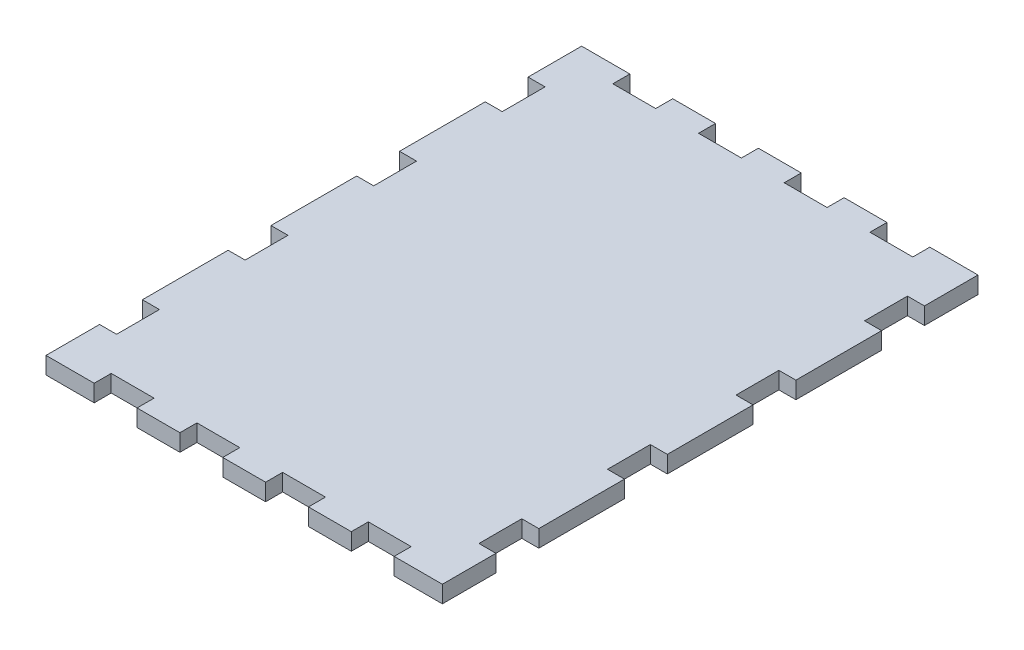
from build123d import *

# Parameters (mm, degrees)
SKETCH1_W           = 74
SKETCH1_H           = 100
BOSS_EXTRUDE1_DEPTH = 3.175
CUT_EXTRUDE1_REACH  = 126.443
SKETCH2_W           = 8
SKETCH2_H           = 3.175
SKETCH2_W_2         = 3.175
SKETCH2_H_2         = 8


with BuildPart() as part:
    # Sketch1 → Boss-Extrude1 (new body)
    with BuildSketch(Plane(origin=(0, 0, 0), x_dir=(1, 0, 0), z_dir=(0, 1, 0))):
        with Locations((37, -50)):
            Rectangle(SKETCH1_W, SKETCH1_H)
    extrude(amount=BOSS_EXTRUDE1_DEPTH)

    # Sketch2 → Cut-Extrude1 (cut, up to next)
    with BuildSketch(Plane(origin=(0, 3.175, 0), x_dir=(1, 0, 0), z_dir=(0, 1, 0)), mode=Mode.PRIVATE) as cut_extrude1_sk1:
        with Locations((61, -1.5875)):
            Rectangle(SKETCH2_W, SKETCH2_H)
    cut_extrude1_tool1 = extrude(cut_extrude1_sk1.sketch, amount=-CUT_EXTRUDE1_REACH, mode=Mode.PRIVATE) & part.part
    # Sketch2 → Cut-Extrude1 (cut, up to next)
    with BuildSketch(Plane(origin=(0, 3.175, 0), x_dir=(1, 0, 0), z_dir=(0, 1, 0)), mode=Mode.PRIVATE) as cut_extrude1_sk2:
        with Locations((45, -1.5875)):
            Rectangle(SKETCH2_W, SKETCH2_H)
    cut_extrude1_tool2 = extrude(cut_extrude1_sk2.sketch, amount=-CUT_EXTRUDE1_REACH, mode=Mode.PRIVATE) & part.part
    # Sketch2 → Cut-Extrude1 (cut, up to next)
    with BuildSketch(Plane(origin=(0, 3.175, 0), x_dir=(1, 0, 0), z_dir=(0, 1, 0)), mode=Mode.PRIVATE) as cut_extrude1_sk3:
        with Locations((13, -1.5875)):
            Rectangle(SKETCH2_W, SKETCH2_H)
    cut_extrude1_tool3 = extrude(cut_extrude1_sk3.sketch, amount=-CUT_EXTRUDE1_REACH, mode=Mode.PRIVATE) & part.part
    # Sketch2 → Cut-Extrude1 (cut, up to next)
    with BuildSketch(Plane(origin=(0, 3.175, 0), x_dir=(1, 0, 0), z_dir=(0, 1, 0)), mode=Mode.PRIVATE) as cut_extrude1_sk4:
        with Locations((29, -1.5875)):
            Rectangle(SKETCH2_W, SKETCH2_H)
    cut_extrude1_tool4 = extrude(cut_extrude1_sk4.sketch, amount=-CUT_EXTRUDE1_REACH, mode=Mode.PRIVATE) & part.part
    # Sketch2 → Cut-Extrude1 (cut, up to next)
    with BuildSketch(Plane(origin=(0, 3.175, 0), x_dir=(1, 0, 0), z_dir=(0, 1, 0)), mode=Mode.PRIVATE) as cut_extrude1_sk5:
        with Locations((1.5875, -14)):
            Rectangle(SKETCH2_W_2, SKETCH2_H_2)
    cut_extrude1_tool5 = extrude(cut_extrude1_sk5.sketch, amount=-CUT_EXTRUDE1_REACH, mode=Mode.PRIVATE) & part.part
    # Sketch2 → Cut-Extrude1 (cut, up to next)
    with BuildSketch(Plane(origin=(0, 3.175, 0), x_dir=(1, 0, 0), z_dir=(0, 1, 0)), mode=Mode.PRIVATE) as cut_extrude1_sk6:
        with Locations((1.5875, -38)):
            Rectangle(SKETCH2_W_2, SKETCH2_H_2)
    cut_extrude1_tool6 = extrude(cut_extrude1_sk6.sketch, amount=-CUT_EXTRUDE1_REACH, mode=Mode.PRIVATE) & part.part
    # Sketch2 → Cut-Extrude1 (cut, up to next)
    with BuildSketch(Plane(origin=(0, 3.175, 0), x_dir=(1, 0, 0), z_dir=(0, 1, 0)), mode=Mode.PRIVATE) as cut_extrude1_sk7:
        with Locations((1.5875, -86)):
            Rectangle(SKETCH2_W_2, SKETCH2_H_2)
    cut_extrude1_tool7 = extrude(cut_extrude1_sk7.sketch, amount=-CUT_EXTRUDE1_REACH, mode=Mode.PRIVATE) & part.part
    # Sketch2 → Cut-Extrude1 (cut, up to next)
    with BuildSketch(Plane(origin=(0, 3.175, 0), x_dir=(1, 0, 0), z_dir=(0, 1, 0)), mode=Mode.PRIVATE) as cut_extrude1_sk8:
        with Locations((1.5875, -62)):
            Rectangle(SKETCH2_W_2, SKETCH2_H_2)
    cut_extrude1_tool8 = extrude(cut_extrude1_sk8.sketch, amount=-CUT_EXTRUDE1_REACH, mode=Mode.PRIVATE) & part.part
    # Sketch2 → Cut-Extrude1 (cut, up to next)
    with BuildSketch(Plane(origin=(0, 3.175, 0), x_dir=(1, 0, 0), z_dir=(0, 1, 0)), mode=Mode.PRIVATE) as cut_extrude1_sk9:
        with Locations((13, -98.4125)):
            Rectangle(SKETCH2_W, SKETCH2_H)
    cut_extrude1_tool9 = extrude(cut_extrude1_sk9.sketch, amount=-CUT_EXTRUDE1_REACH, mode=Mode.PRIVATE) & part.part
    # Sketch2 → Cut-Extrude1 (cut, up to next)
    with BuildSketch(Plane(origin=(0, 3.175, 0), x_dir=(1, 0, 0), z_dir=(0, 1, 0)), mode=Mode.PRIVATE) as cut_extrude1_sk10:
        with Locations((29, -98.4125)):
            Rectangle(SKETCH2_W, SKETCH2_H)
    cut_extrude1_tool10 = extrude(cut_extrude1_sk10.sketch, amount=-CUT_EXTRUDE1_REACH, mode=Mode.PRIVATE) & part.part
    # Sketch2 → Cut-Extrude1 (cut, up to next)
    with BuildSketch(Plane(origin=(0, 3.175, 0), x_dir=(1, 0, 0), z_dir=(0, 1, 0)), mode=Mode.PRIVATE) as cut_extrude1_sk11:
        with Locations((61, -98.4125)):
            Rectangle(SKETCH2_W, SKETCH2_H)
    cut_extrude1_tool11 = extrude(cut_extrude1_sk11.sketch, amount=-CUT_EXTRUDE1_REACH, mode=Mode.PRIVATE) & part.part
    # Sketch2 → Cut-Extrude1 (cut, up to next)
    with BuildSketch(Plane(origin=(0, 3.175, 0), x_dir=(1, 0, 0), z_dir=(0, 1, 0)), mode=Mode.PRIVATE) as cut_extrude1_sk12:
        with Locations((45, -98.4125)):
            Rectangle(SKETCH2_W, SKETCH2_H)
    cut_extrude1_tool12 = extrude(cut_extrude1_sk12.sketch, amount=-CUT_EXTRUDE1_REACH, mode=Mode.PRIVATE) & part.part
    # Sketch2 → Cut-Extrude1 (cut, up to next)
    with BuildSketch(Plane(origin=(0, 3.175, 0), x_dir=(1, 0, 0), z_dir=(0, 1, 0)), mode=Mode.PRIVATE) as cut_extrude1_sk13:
        with Locations((72.4125, -86)):
            Rectangle(SKETCH2_W_2, SKETCH2_H_2)
    cut_extrude1_tool13 = extrude(cut_extrude1_sk13.sketch, amount=-CUT_EXTRUDE1_REACH, mode=Mode.PRIVATE) & part.part
    # Sketch2 → Cut-Extrude1 (cut, up to next)
    with BuildSketch(Plane(origin=(0, 3.175, 0), x_dir=(1, 0, 0), z_dir=(0, 1, 0)), mode=Mode.PRIVATE) as cut_extrude1_sk14:
        with Locations((72.4125, -62)):
            Rectangle(SKETCH2_W_2, SKETCH2_H_2)
    cut_extrude1_tool14 = extrude(cut_extrude1_sk14.sketch, amount=-CUT_EXTRUDE1_REACH, mode=Mode.PRIVATE) & part.part
    # Sketch2 → Cut-Extrude1 (cut, up to next)
    with BuildSketch(Plane(origin=(0, 3.175, 0), x_dir=(1, 0, 0), z_dir=(0, 1, 0)), mode=Mode.PRIVATE) as cut_extrude1_sk15:
        with Locations((72.4125, -14)):
            Rectangle(SKETCH2_W_2, SKETCH2_H_2)
    cut_extrude1_tool15 = extrude(cut_extrude1_sk15.sketch, amount=-CUT_EXTRUDE1_REACH, mode=Mode.PRIVATE) & part.part
    # Sketch2 → Cut-Extrude1 (cut, up to next)
    with BuildSketch(Plane(origin=(0, 3.175, 0), x_dir=(1, 0, 0), z_dir=(0, 1, 0)), mode=Mode.PRIVATE) as cut_extrude1_sk16:
        with Locations((72.4125, -38)):
            Rectangle(SKETCH2_W_2, SKETCH2_H_2)
    cut_extrude1_tool16 = extrude(cut_extrude1_sk16.sketch, amount=-CUT_EXTRUDE1_REACH, mode=Mode.PRIVATE) & part.part
    add(cut_extrude1_tool1.solids().sort_by_distance((61, 3.175, 1.5875))[0], mode=Mode.SUBTRACT)
    add(cut_extrude1_tool2.solids().sort_by_distance((45, 3.175, 1.5875))[0], mode=Mode.SUBTRACT)
    add(cut_extrude1_tool3.solids().sort_by_distance((13, 3.175, 1.5875))[0], mode=Mode.SUBTRACT)
    add(cut_extrude1_tool4.solids().sort_by_distance((29, 3.175, 1.5875))[0], mode=Mode.SUBTRACT)
    add(cut_extrude1_tool5.solids().sort_by_distance((1.5875, 3.175, 14))[0], mode=Mode.SUBTRACT)
    add(cut_extrude1_tool6.solids().sort_by_distance((1.5875, 3.175, 38))[0], mode=Mode.SUBTRACT)
    add(cut_extrude1_tool7.solids().sort_by_distance((1.5875, 3.175, 86))[0], mode=Mode.SUBTRACT)
    add(cut_extrude1_tool8.solids().sort_by_distance((1.5875, 3.175, 62))[0], mode=Mode.SUBTRACT)
    add(cut_extrude1_tool9.solids().sort_by_distance((13, 3.175, 98.4125))[0], mode=Mode.SUBTRACT)
    add(cut_extrude1_tool10.solids().sort_by_distance((29, 3.175, 98.4125))[0], mode=Mode.SUBTRACT)
    add(cut_extrude1_tool11.solids().sort_by_distance((61, 3.175, 98.4125))[0], mode=Mode.SUBTRACT)
    add(cut_extrude1_tool12.solids().sort_by_distance((45, 3.175, 98.4125))[0], mode=Mode.SUBTRACT)
    add(cut_extrude1_tool13.solids().sort_by_distance((72.4125, 3.175, 86))[0], mode=Mode.SUBTRACT)
    add(cut_extrude1_tool14.solids().sort_by_distance((72.4125, 3.175, 62))[0], mode=Mode.SUBTRACT)
    add(cut_extrude1_tool15.solids().sort_by_distance((72.4125, 3.175, 14))[0], mode=Mode.SUBTRACT)
    add(cut_extrude1_tool16.solids().sort_by_distance((72.4125, 3.175, 38))[0], mode=Mode.SUBTRACT)


solid = part.part
